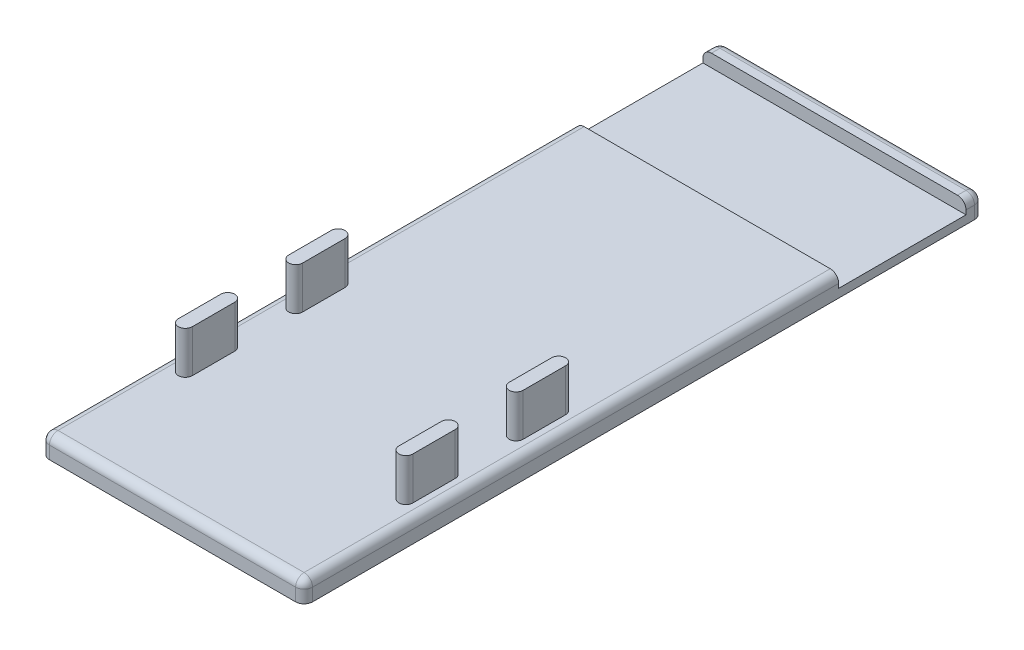
from build123d import *

# Parameters (mm, degrees)
SKETCH1_W            = 78.74
SKETCH1_H            = 203.2
BOSS_EXTRUDE1_DEPTH  = 6.35
BOSS_EXTRUDE2_DEPTH  = 12.7
LPATTERN2_COUNT      = 2
LPATTERN2_PITCH      = 65.9892
LPATTERN2_COUNT_DIR2 = 2
LPATTERN2_PITCH_DIR2 = 33.02
SKETCH3_W            = 38.1
SKETCH3_H            = 3.81
CUT_EXTRUDE1_DEPTH   = 219.753583056
FILLET1_R            = 2.54


with BuildPart() as part:
    # Sketch1 → Boss-Extrude1 (new body)
    with BuildSketch(Plane(origin=(0, 0, 0), x_dir=(1, 0, 0), z_dir=(0, 1, 0))):
        with Locations((39.37, -101.6)):
            Rectangle(SKETCH1_W, SKETCH1_H)
    extrude(amount=BOSS_EXTRUDE1_DEPTH)

    # Sketch2 → Boss-Extrude2 (add)
    with BuildSketch(Plane(origin=(0, 6.35, 0), x_dir=(1, 0, 0), z_dir=(0, 1, 0))):
        with BuildLine():
            Line((4.2926, -133.35), (4.2926, -120.65))
            ThreePointArc((4.2926, -120.65), (6.3754, -118.5672), (8.4582, -120.65))
            Line((8.4582, -120.65), (8.4582, -133.35))
            ThreePointArc((8.4582, -133.35), (6.3754, -135.4328), (4.2926, -133.35))
        make_face()
    boss_extrude2 = extrude(amount=BOSS_EXTRUDE2_DEPTH)

    # LPattern2: Boss-Extrude2 2 × 2
    with Locations(*[(i * LPATTERN2_PITCH, 0, j * LPATTERN2_PITCH_DIR2) for i in range(LPATTERN2_COUNT) for j in range(LPATTERN2_COUNT_DIR2) if (i, j) != (0, 0)]):
        add(boss_extrude2)

    # Sketch3 → Cut-Extrude1 (cut, through all)
    with BuildSketch(Plane(origin=(78.74, 0, 0), x_dir=(0, 0, -1), z_dir=(1, 0, 0))):
        with Locations((-24.13, 4.445)):
            Rectangle(SKETCH3_W, SKETCH3_H)
    extrude(amount=-CUT_EXTRUDE1_DEPTH, mode=Mode.SUBTRACT)

    # Fillet1
    fillet1_edges = [part.edges().sort_by_distance(p)[0] for p in [
        (0, 6.35, 2.54),
        (78.74, 6.35, 2.54),
        (39.37, 6.35, 0),
        (0, 3.175, 0),
        (78.74, 3.175, 0),
        (0, 3.175, 203.2),
        (78.74, 3.175, 203.2),
        (0, 6.35, 123.19),
        (39.37, 6.35, 203.2),
        (78.74, 6.35, 123.19),
    ]]
    fillet(fillet1_edges, radius=FILLET1_R)


solid = part.part
